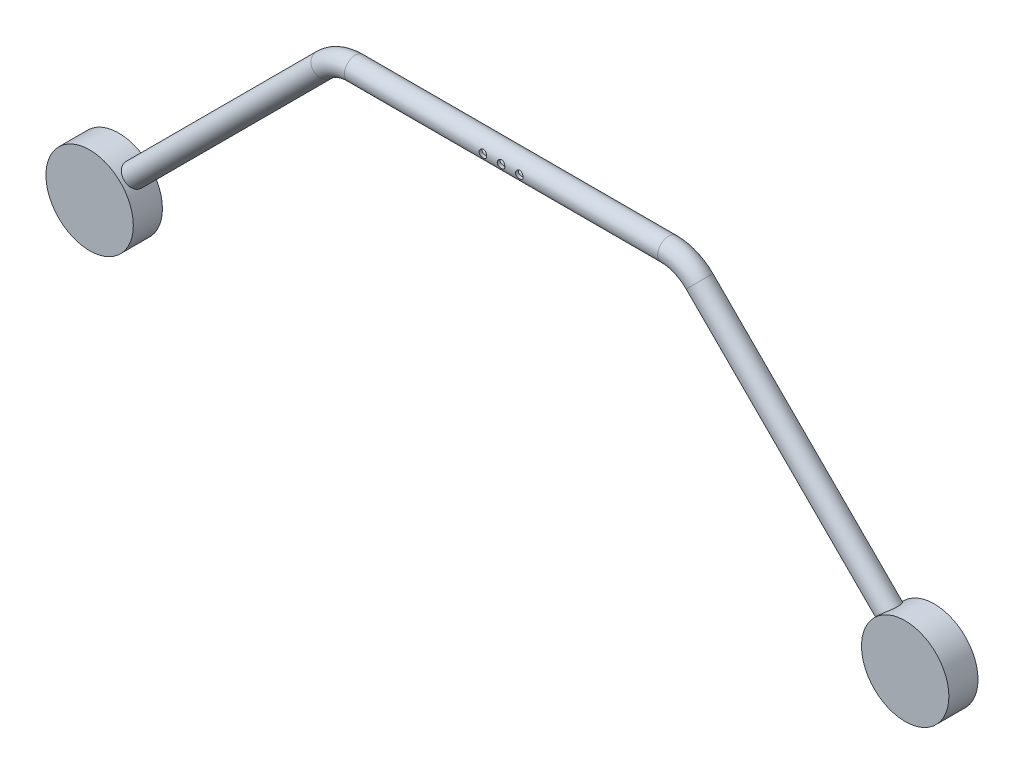
from build123d import *

# Parameters (mm, degrees)
SKETCH1_R                     = 38.1
BOSS_EXTRUDE1_DEPTH           = 25.4
BOSS_EXTRUDE1_2_DEPTH         = 25.4
SWEEP1_PROFILE_R              = 9.525
SHELL1_T                      = -2.54
M6_CLEARANCE_HOLE1_AT_2_COUNT = 2
M6_CLEARANCE_HOLE1_AT_2_PITCH = 31.75


with BuildPart() as part:
    # Sketch1 → Boss-Extrude1 (new body)
    with BuildSketch(Plane.XY):
        with Locations((-355.6, -203.2)):
            Circle(SKETCH1_R)
    extrude(amount=BOSS_EXTRUDE1_DEPTH)


with BuildPart() as body_2:
    # Sketch1 → Boss-Extrude1 2 (new body)
    with BuildSketch(Plane.XY):
        with Locations((355.6, -203.2)):
            Circle(SKETCH1_R)
    extrude(amount=BOSS_EXTRUDE1_2_DEPTH)


with BuildPart() as body_3:
    # Sweep1: sweep along a path in Sketch4
    with BuildLine(Plane.XY.offset(12.7)) as sweep1_path:
        Line((-355.6, -203.2), (-163.559231637, -11.159231637))
        ThreePointArc((-163.559231637, -11.159231637), (-151.198702047, -2.900189811), (-136.618463274, 0))
        Line((-136.618463274, 0), (136.618463274, 0))
        ThreePointArc((136.618463274, 0), (151.198702047, -2.900189811), (163.559231637, -11.159231637))
        Line((163.559231637, -11.159231637), (355.6, -203.2))
    # Sweep1 profile (on start of the path) → Sweep1 (sweep)
    with BuildSketch(Plane(origin=(-355.6, -203.2, 12.7), x_dir=(0.7071067811865491, -0.7071067811865459, 0), z_dir=(0.7071067811865459, 0.7071067811865491, 0))):
        Circle(SWEEP1_PROFILE_R)
    sweep(path=sweep1_path.line)

    # Shell1
    shell1_openings = [body_3.faces().sort_by_distance(p)[0] for p in [
        (355.6, -203.2, 12.7),
        (-355.6, -203.2, 12.7),
    ]]
    offset(amount=SHELL1_T, openings=shell1_openings, kind=Kind.INTERSECTION)

    # Sketch49 → M6 Clearance Hole1 (revolve, cut)
    with BuildSketch(Plane(origin=(-15.875, 0, 22.225), x_dir=(0, -1, 0), z_dir=(1, 0, 0))):
        Polygon((0, 0), (0, 22.225), (3.3, 22.225), (3.3, 0.025), (3.325, 0), align=None)
    m6_clearance_hole1 = revolve(axis=Axis((-15.875, 0, 28.575), (0, 0, -1)), mode=Mode.SUBTRACT)

    # M6 Clearance Hole1 at 2: M6 Clearance Hole1 ×2
    with Locations(*[(i * M6_CLEARANCE_HOLE1_AT_2_PITCH, 0, 0) for i in range(1, M6_CLEARANCE_HOLE1_AT_2_COUNT)]):
        add(m6_clearance_hole1, mode=Mode.SUBTRACT)

    # Sketch51 → M6 Clearance Hole2 (revolve, cut)
    with BuildSketch(Plane(origin=(0, 0, 22.225), x_dir=(0, -1, 0), z_dir=(1, 0, 0))):
        Polygon((0, 0), (0, 22.225), (3.3, 22.225), (3.3, 0.025), (3.325, 0), align=None)
    revolve(axis=Axis((0, 0, 28.575), (0, 0, -1)), mode=Mode.SUBTRACT)


solid = Compound([part.part, body_2.part, body_3.part])
